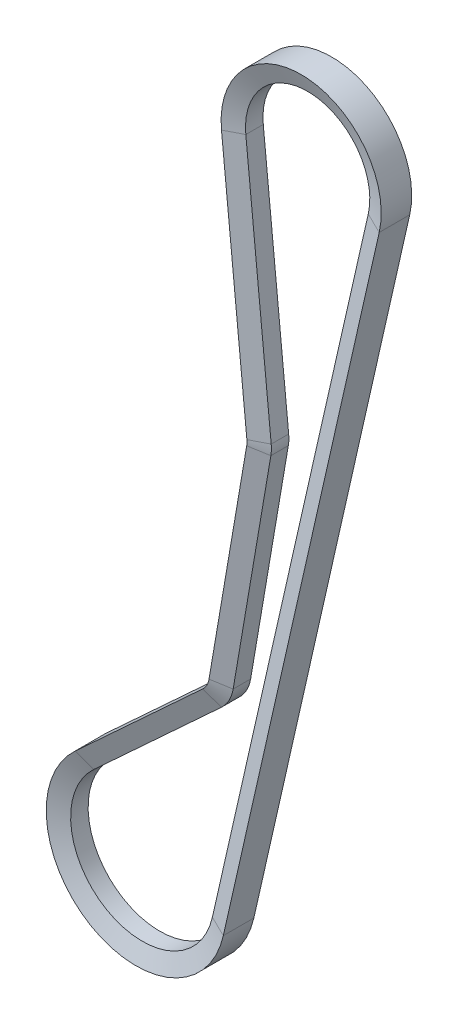
from build123d import *


with BuildPart() as part:
    # Sweep1: sweep along a path in Sketch2
    with BuildLine(Plane.XY) as sweep1_path:
        Line((24.380155181, -5.532452742), (-24.300902185, -220.057870009))
        ThreePointArc((-24.300902185, -220.057870009), (-65.63023167, -238.096619102), (-70.585785727, -193.275280116))
        Line((-70.585785727, -193.275280116), (-30.726296722, -156.527553856))
        ThreePointArc((-30.726296722, -156.527553856), (-29.450133663, -154.889094177), (-28.770879545, -152.926505041))
        Line((-28.770879545, -152.926505041), (-17.001873597, -83.922950792))
        ThreePointArc((-17.001873597, -83.922950792), (-16.915344882, -83.076799571), (-16.942677423, -82.226674852))
        Line((-16.942677423, -82.226674852), (-24.877182319, -2.475035323))
        ThreePointArc((-24.877182319, -2.475035323), (1.548776715, 24.951979695), (24.380155181, -5.532452742))
    # Sketch3 → Sweep1 (sweep)
    with BuildSketch(Plane(origin=(-24.877182319, -2.475035323, 0), x_dir=(0.9950872927732508, 0.09900141292528411, 0), z_dir=(-0.09900141292528411, 0.9950872927732508, 0))):
        Polygon((0, -4.7625), (0, 4.7625), (5.588, 2.728634331), (5.588, -2.728634331), align=None)
    sweep(path=sweep1_path.line)


solid = part.part
